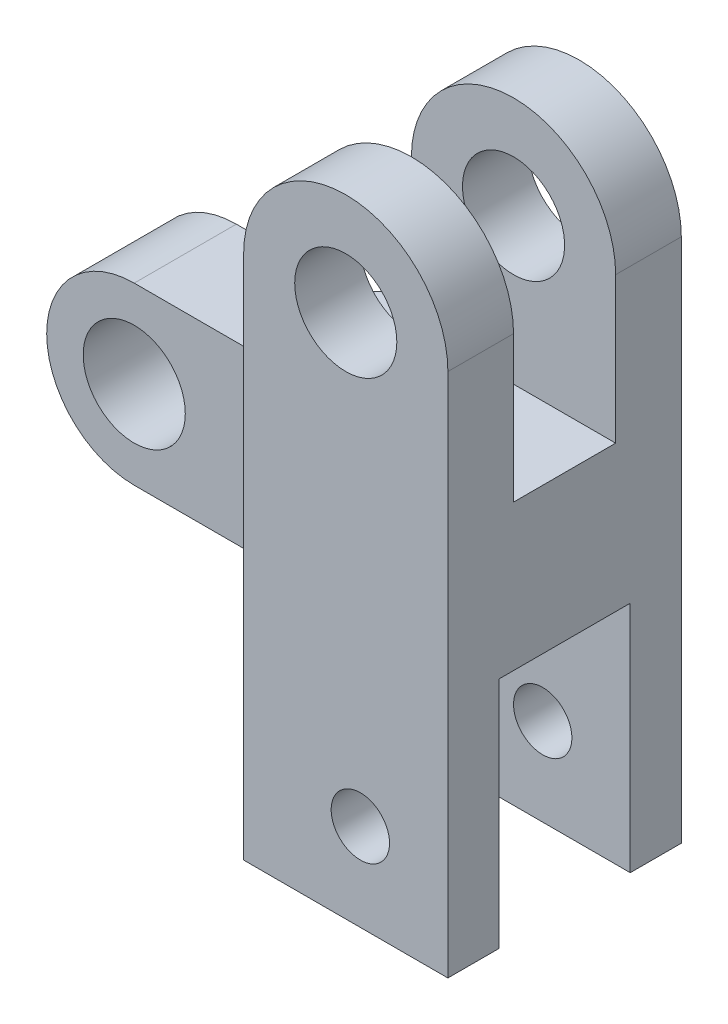
from build123d import *

# Parameters (mm, degrees)
SKETCH_1_W          = 7
SKETCH_1_H          = 7
EXTRUDE_1_DEPTH     = 2.4
EXTRUDE_6_DEPTH     = 1.75
EXTRUDE_START       = -5.25
EXTRUDE_8_DEPTH     = 1.75
SKETCH_11_R         = 1.75
CUT_EXTRUDE_1_DEPTH = 17.740669043
SKETCH_17_W         = 7
SKETCH_17_H         = 7
EXTRUDE_10_DEPTH    = 8
SKETCH_15_R         = 1.75
EXTRUDE_9_DEPTH     = 1.75
SKETCH_12_R         = 1
CUT_EXTRUDE_2_DEPTH = 17.552945357
SKETCH_18_W         = 7
SKETCH_18_H         = 4.5
CUT_EXTRUDE_4_DEPTH = 6
SKETCH_19_R         = 1
SKETCH_19_R_2       = 1.75
EXTRUDE_11_DEPTH    = 0.5
EXTRUDE_START_2     = 0.5
SKETCH_20_R         = 1
SKETCH_20_R_2       = 1.75
EXTRUDE_12_DEPTH    = 0.5
SKETCH_22_W         = 4.5
SKETCH_22_H         = 2
CUT_EXTRUDE_5_DEPTH = 7
CHAMFER_1_SIZE      = 1
CHAMFER_START       = -8
CHAMFER_2_DEPTH     = 13
CHAMFER_START_2     = -1
CHAMFER_2_2_DEPTH   = 6
CHAMFER_START_3     = -2.25
CHAMFER_2_3_DEPTH   = 4.5
SKETCH_23_W         = 8
SKETCH_23_H         = 7
CUT_EXTRUDE_6_DEPTH = 17.710774967


with BuildPart() as part:
    # 草图1 → 凸台-拉伸1 (new body)
    with BuildSketch(Plane(origin=(0, 0, 0), x_dir=(1, 0, 0), z_dir=(0, 1, 0))):
        with Locations((3.5, 0)):
            Rectangle(SKETCH_1_W, SKETCH_1_H)
    extrude(amount=EXTRUDE_1_DEPTH)

    # 草图10 → 凸台-拉伸6 (add)
    with BuildSketch(Plane(origin=(0, 0, -3.5), x_dir=(-1, 0, 0), z_dir=(0, 0, -1))):
        with BuildLine():
            Line((0, 2.4), (0, 10))
            ThreePointArc((0, 10), (-3.5, 13.5), (-7, 10))
            Line((-7, 10), (-7, 2.4))
            Line((-7, 2.4), (0, 2.4))
        make_face()
    extrude(amount=-EXTRUDE_6_DEPTH)

    # 草图10<2> → 凸台-拉伸8 (add)
    with BuildSketch(Plane(origin=(0, 0, -3.5), x_dir=(-1, 0, 0), z_dir=(0, 0, -1)).offset(EXTRUDE_START)):
        with BuildLine():
            Line((0, 2.4), (0, 10))
            ThreePointArc((0, 10), (-3.5, 13.5), (-7, 10))
            Line((-7, 10), (-7, 2.4))
            Line((-7, 2.4), (0, 2.4))
        make_face()
    extrude(amount=-EXTRUDE_8_DEPTH)

    # 草图11 → 切除-拉伸1 (cut, through all)
    with BuildSketch(Plane(origin=(0, 0, -3.5), x_dir=(-1, 0, 0), z_dir=(0, 0, -1))):
        with Locations((-3.5, 10)):
            Circle(SKETCH_11_R)
    extrude(amount=-CUT_EXTRUDE_1_DEPTH, mode=Mode.SUBTRACT)

    # 草图17 → 凸台-拉伸10 (add)
    with BuildSketch(Plane.XZ):
        with Locations((3.5, 0)):
            Rectangle(SKETCH_17_W, SKETCH_17_H)
    extrude(amount=EXTRUDE_10_DEPTH)

    # 草图15 → 凸台-拉伸9 (add, symmetric)
    with BuildSketch(Plane.XY):
        with BuildLine():
            ThreePointArc((-6, -1), (-9, 2), (-6, 5))
            Line((-6, 5), (7, 5))
            Line((7, 5), (7, -1))
            Line((7, -1), (-6, -1))
        make_face()
        with Locations((-6, 2)):
            Circle(SKETCH_15_R, mode=Mode.SUBTRACT)
    extrude(amount=EXTRUDE_9_DEPTH, both=True)

    # 草图12 → 切除-拉伸2 (cut, through all)
    with BuildSketch(Plane(origin=(0, 4, 3.5), x_dir=(1, 0, 0), z_dir=(0, 0, -1))):
        with Locations(Location((4, 9, 0), (0, 0, 180))):
            Circle(SKETCH_12_R)
    extrude(amount=CUT_EXTRUDE_2_DEPTH, mode=Mode.SUBTRACT)

    # 草图18 → 切除-拉伸4 (cut)
    with BuildSketch(Plane(origin=(7.4, -8, 0), x_dir=(1, 0, 0), z_dir=(0, 1, 0))):
        with Locations((-3.9, 0)):
            Rectangle(SKETCH_18_W, SKETCH_18_H)
    extrude(amount=CUT_EXTRUDE_4_DEPTH, mode=Mode.SUBTRACT)

    # 草图19 → 凸台-拉伸11 (add)
    with BuildSketch(Plane.XY.offset(3.5)):
        with BuildLine():
            Line((0, 10), (0, -8))
            Line((0, -8), (7, -8))
            Line((7, -8), (7, 10))
            ThreePointArc((7, 10), (3.5, 13.5), (0, 10))
        make_face()
        with Locations((4, -5)):
            Circle(SKETCH_19_R, mode=Mode.SUBTRACT)
        with Locations(Location((3.5, 10, 0), (0, 0, 180))):
            Circle(SKETCH_19_R_2, mode=Mode.SUBTRACT)
    extrude(amount=EXTRUDE_11_DEPTH)

    # 草图20 → 凸台-拉伸12 (add)
    with BuildSketch(Plane(origin=(0, 0, -3.5), x_dir=(-1, 0, 0), z_dir=(0, 0, -1)).offset(EXTRUDE_START_2)):
        with BuildLine():
            Line((-7, 10), (-7, -8))
            Line((-7, -8), (0, -8))
            Line((0, -8), (0, 10))
            ThreePointArc((0, 10), (-3.5, 13.5), (-7, 10))
        make_face()
        with Locations(Location((-4, -5, 0), (0, 0, 180))):
            Circle(SKETCH_20_R, mode=Mode.SUBTRACT)
        with Locations((-3.5, 10)):
            Circle(SKETCH_20_R_2, mode=Mode.SUBTRACT)
    extrude(amount=-EXTRUDE_12_DEPTH)

    # 草图22 → 切除-拉伸5 (cut)
    with BuildSketch(Plane(origin=(7, 0, 0), x_dir=(0, 0, -1), z_dir=(1, 0, 0))):
        with Locations((0, -1)):
            Rectangle(SKETCH_22_W, SKETCH_22_H)
    extrude(amount=-CUT_EXTRUDE_5_DEPTH, mode=Mode.SUBTRACT)

    # 倒角1
    chamfer_1_edges = [part.edges().sort_by_distance(p)[0] for p in [
        (0, -1, 0),
    ]]
    chamfer(chamfer_1_edges, length=CHAMFER_1_SIZE - 0.0001)  # a hair under: the kernel refuses the full size

    # 倒角2: read off the stored shape, not the designer's step
    # 倒角2 outline → 倒角2 (add)
    with BuildSketch(Plane(origin=(0, 0, 0), x_dir=(1, 0, 0), z_dir=(0, 1, 0)).offset(CHAMFER_START)):
        Polygon((0, -3.75), (0, -2.25), (-1.5, -2.25), align=None)
        Polygon((0, 3.75), (-1.5, 2.25), (0, 2.25), align=None)
    extrude(amount=CHAMFER_2_DEPTH)

    # Chamfer 2 2 outline → Chamfer 2 2 (add)
    with BuildSketch(Plane(origin=(0, 0, 0), x_dir=(1, 0, 0), z_dir=(0, 1, 0)).offset(CHAMFER_START_2)):
        Polygon((-1.5, -2.25), (0, -2.25), (0, -1.75), (-2, -1.75), align=None)
        Polygon((0, 2.25), (-1.5, 2.25), (-2, 1.75), (0, 1.75), align=None)
    extrude(amount=CHAMFER_2_2_DEPTH)

    # Chamfer 2 3 outline → Chamfer 2 3 (cut)
    with BuildSketch(Plane.XY.offset(CHAMFER_START_3)):
        Polygon((0, 0), (-1, -1), (0, -1), align=None)
    extrude(amount=CHAMFER_2_3_DEPTH, mode=Mode.SUBTRACT)

    # 草图23 → 切除-拉伸6 (cut, through all)
    with BuildSketch(Plane.ZY):
        with Locations((0, -4.5)):
            Rectangle(SKETCH_23_W, SKETCH_23_H)
    extrude(amount=CUT_EXTRUDE_6_DEPTH, mode=Mode.SUBTRACT)


solid = part.part
